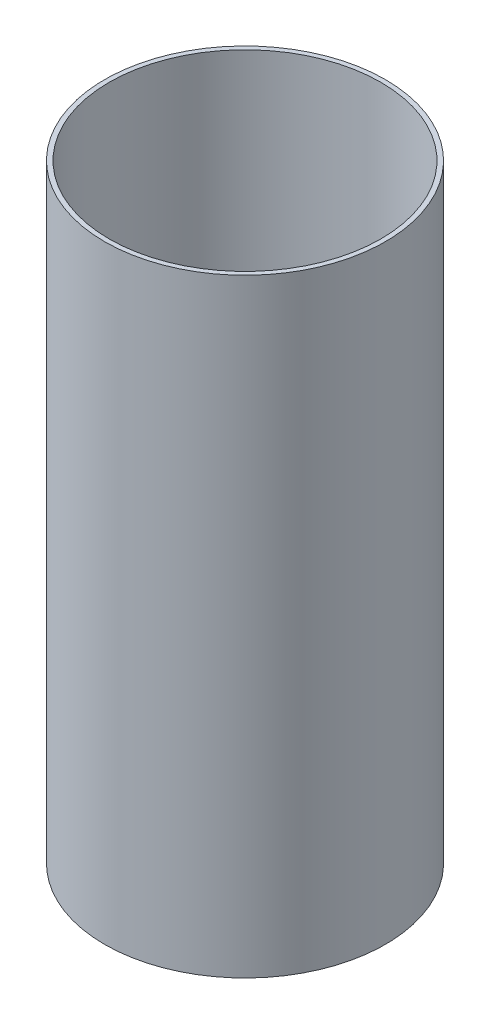
from build123d import *

# Parameters (mm, degrees)
SKETCH1_R           = 76.1746
SKETCH1_R_2         = 73.66
BOSS_EXTRUDE1_DEPTH = 330.2


with BuildPart() as part:
    # Sketch1 → Boss-Extrude1 (new body)
    with BuildSketch(Plane(origin=(0, 0, 0), x_dir=(1, 0, 0), z_dir=(0, 1, 0))):
        Circle(SKETCH1_R)
        Circle(SKETCH1_R_2, mode=Mode.SUBTRACT)
    extrude(amount=BOSS_EXTRUDE1_DEPTH)


solid = part.part
